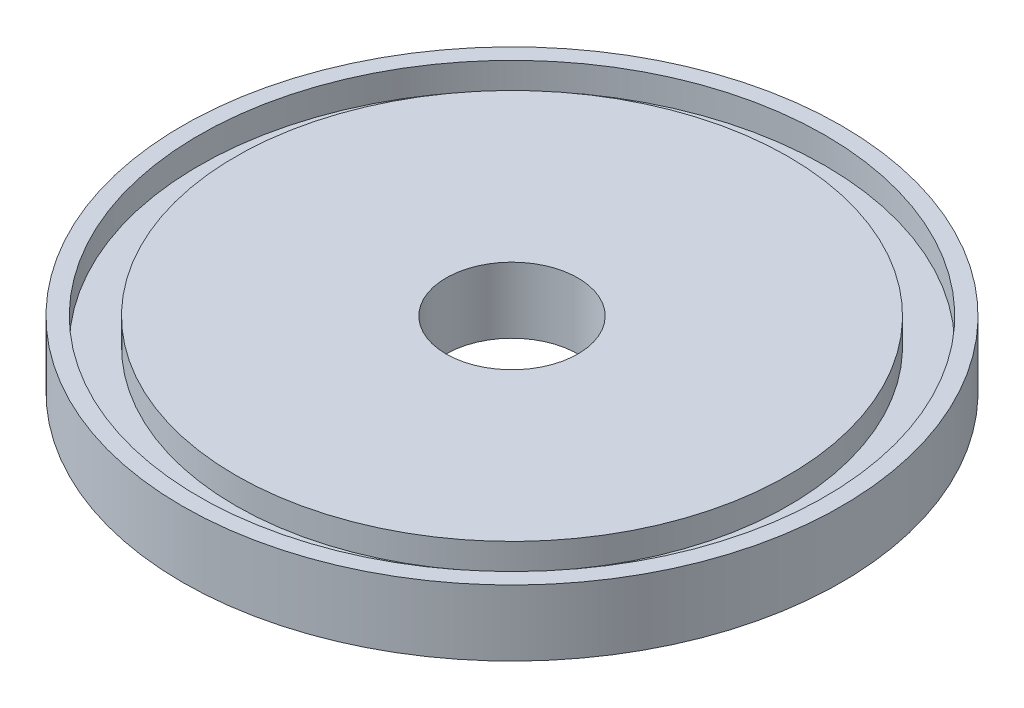
from build123d import *

# Parameters (mm, degrees)
F_1_2_0_5_DIAMETER_HOLE1_D = 12.7


with BuildPart() as part:
    # Sketch1 → Revolve1 (revolve)
    with BuildSketch(Plane.XY):
        Polygon((-26.6065, 6.35), (-26.6065, 3.81), (-30.1625, 3.81), (-30.1625, 6.35), (-31.75, 6.35), (-31.75, 0), (0, 0), (0, 6.35), align=None)
    revolve(axis=Axis((0, 0, 0), (0, 1, 0)))

    # 1/2 (0.5) Diameter Hole1 (through all)
    with Locations(Plane(origin=(0, 6.35, 0), x_dir=(1, 0, 0), z_dir=(0, 1, 0))):
        with Locations((0, 0)):
            Hole(F_1_2_0_5_DIAMETER_HOLE1_D / 2)


solid = part.part
